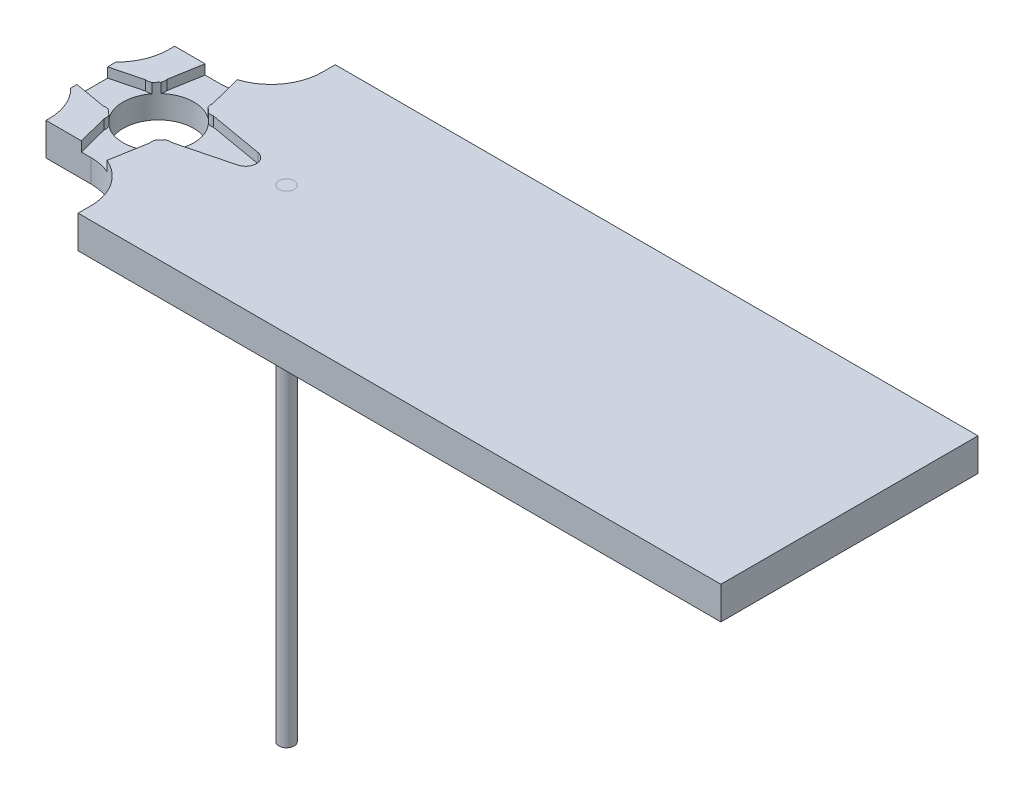
from build123d import *

# Parameters (mm, degrees)
SKETCH1_R           = 1.5
BOSS_EXTRUDE1_DEPTH = 6.4516
SKETCH2_3_R         = 6.985
CUT_EXTRUDE2_DEPTH  = 19.97964
CAVITY1_START       = 4.521642996
CAVITY1_OUTLINE_R   = 0.7575
CAVITY1_DEPTH       = 1.929957004
SKETCH3_R           = 0.7575
CUT_EXTRUDE3_DEPTH  = 139.94128573
SKETCH4_R           = 1.5
BOSS_EXTRUDE2_DEPTH = 95.25
FILLET1_R           = 10.16


with BuildPart() as part:
    # Sketch1 → Boss-Extrude1 (new body)
    with BuildSketch(Plane(origin=(0, 0, 0), x_dir=(1, 0, 0), z_dir=(0, 1, 0))):
        Polygon((-12.598868717, 4.18434255), (-12.598868717, -4.742883604), (-9.525, -5.534097084), (-9.525, -12.7), (9.525, -12.7), (9.525, -25.4), (136.525, -25.4), (136.525, 25.4), (9.525, 25.4), (9.525, 12.7), (-9.525, 12.7), (-9.525, 4.975556031), align=None)
        with Locations(Location((25.298868717, 0, 0), (0, 0, 270))):
            Circle(SKETCH1_R, mode=Mode.SUBTRACT)
    extrude(amount=BOSS_EXTRUDE1_DEPTH)

    # Sketch2<3> → Cut-Extrude2 (cut)
    with BuildSketch(Plane(origin=(0, 6.4516, 0), x_dir=(1, 0, 0), z_dir=(0, 1, 0))):
        with Locations(Location((0, 0, 0), (0, 0, 270))):
            Circle(SKETCH2_3_R)
    extrude(amount=-CUT_EXTRUDE2_DEPTH, mode=Mode.SUBTRACT)

    # Cavity1: read off the stored shape, not the designer's step
    # Cavity1 outline → Cavity1 (cut)
    # profile 1 of 4: a face of its own
    with BuildSketch(Plane(origin=(0, 0, 0), x_dir=(1, 0, 0), z_dir=(0, 1, 0)).offset(CAVITY1_START)):
        with BuildLine():
            ThreePointArc((-0.835841276, 6.934810333), (-0.328024221, 8.224961542), (0.280923041, 6.979348626))
            ThreePointArc((0.280923041, 6.979348626), (2.378348231, 6.567623976), (4.253065237, 5.540907966))
            ThreePointArc((4.253065237, 5.540907966), (4.081154126, 6.075770836), (4.081735433, 6.637581642))
            Line((4.081735433, 6.637581642), (2.521269592, 12.7))
            Line((2.521269592, 12.7), (-3.482705917, 12.7))
            Line((-3.482705917, 12.7), (-4.59736509, 6.291445655))
            ThreePointArc((-4.59736509, 6.291445655), (-4.552045019, 5.731465467), (-4.680815563, 5.184610947))
            ThreePointArc((-4.680815563, 5.184610947), (-2.893816709, 6.357361863), (-0.835841276, 6.934810333))
        make_face()
        with Locations((-0.418583054, 10.495656446)):
            Circle(CAVITY1_OUTLINE_R, mode=Mode.SUBTRACT)
    # profile 2 of 4: a face of its own
    with BuildSketch(Plane(origin=(0, 0, 0), x_dir=(1, 0, 0), z_dir=(0, 1, 0)).offset(CAVITY1_START)):
        with BuildLine():
            ThreePointArc((6.291445655, 4.59736509), (5.731465467, 4.552045019), (5.184610947, 4.680815563))
            ThreePointArc((5.184610947, 4.680815563), (6.357361863, 2.893816709), (6.934810333, 0.835841276))
            ThreePointArc((6.934810333, 0.835841276), (8.224961542, 0.328024221), (6.979348626, -0.280923041))
            ThreePointArc((6.979348626, -0.280923041), (6.567623976, -2.378348231), (5.540907966, -4.253065237))
            ThreePointArc((5.540907966, -4.253065237), (6.075770836, -4.081154126), (6.637581642, -4.081735433))
            Line((6.637581642, -4.081735433), (17.079554107, -1.39397283))
            ThreePointArc((17.079554107, -1.39397283), (18.670158101, 0.744594857), (16.914297994, 2.749700365))
            Line((16.914297994, 2.749700365), (6.291445655, 4.59736509))
        make_face()
        with Locations((10.495656446, 0.418583054)):
            Circle(CAVITY1_OUTLINE_R, mode=Mode.SUBTRACT)
        with Locations((13.523249651, 0.539328166)):
            Circle(CAVITY1_OUTLINE_R, mode=Mode.SUBTRACT)
        with Locations((16.550842857, 0.660073278)):
            Circle(CAVITY1_OUTLINE_R, mode=Mode.SUBTRACT)
    # profile 3 of 4: a face of its own
    with BuildSketch(Plane(origin=(0, 0, 0), x_dir=(1, 0, 0), z_dir=(0, 1, 0)).offset(CAVITY1_START)):
        with BuildLine():
            ThreePointArc((-6.979348626, 0.280923041), (-6.567623976, 2.378348231), (-5.540907966, 4.253065237))
            ThreePointArc((-5.540907966, 4.253065237), (-6.075770836, 4.081154126), (-6.637581642, 4.081735433))
            Line((-6.637581642, 4.081735433), (-12.598868717, 2.547300773))
            Line((-12.598868717, 2.547300773), (-12.598868717, -3.500295986))
            Line((-12.598868717, -3.500295986), (-6.291445655, -4.59736509))
            ThreePointArc((-6.291445655, -4.59736509), (-5.731465467, -4.552045019), (-5.184610947, -4.680815563))
            ThreePointArc((-5.184610947, -4.680815563), (-6.357361863, -2.893816709), (-6.934810333, -0.835841276))
            ThreePointArc((-6.934810333, -0.835841276), (-8.224961542, -0.328024221), (-6.979348626, 0.280923041))
        make_face()
        with Locations((-10.495656446, -0.418583054)):
            Circle(CAVITY1_OUTLINE_R, mode=Mode.SUBTRACT)
    # profile 4 of 4: a face of its own
    with BuildSketch(Plane(origin=(0, 0, 0), x_dir=(1, 0, 0), z_dir=(0, 1, 0)).offset(CAVITY1_START)):
        with BuildLine():
            ThreePointArc((4.59736509, -6.291445655), (4.552045019, -5.731465467), (4.680815563, -5.184610947))
            ThreePointArc((4.680815563, -5.184610947), (2.893816709, -6.357361863), (0.835841276, -6.934810333))
            ThreePointArc((0.835841276, -6.934810333), (0.328024221, -8.224961542), (-0.280923041, -6.979348626))
            ThreePointArc((-0.280923041, -6.979348626), (-2.378348231, -6.567623976), (-4.253065237, -5.540907966))
            ThreePointArc((-4.253065237, -5.540907966), (-4.081154126, -6.075770836), (-4.081735433, -6.637581642))
            Line((-4.081735433, -6.637581642), (-2.521269592, -12.7))
            Line((-2.521269592, -12.7), (3.482705917, -12.7))
            Line((3.482705917, -12.7), (4.59736509, -6.291445655))
        make_face()
        with Locations((0.418583054, -10.495656446)):
            Circle(CAVITY1_OUTLINE_R, mode=Mode.SUBTRACT)
    extrude(amount=CAVITY1_DEPTH, mode=Mode.SUBTRACT)

    # Sketch3 → Cut-Extrude3 (cut, through all)
    with BuildSketch(Plane(origin=(0, 4.521642996, 0), x_dir=(1, 0, 0), z_dir=(0, 1, 0))):
        with Locations((0.418583054, -10.495656446)):
            Circle(SKETCH3_R)
        with Locations((16.550842857, 0.660073278)):
            Circle(SKETCH3_R)
        with Locations((13.523249651, 0.539328166)):
            Circle(SKETCH3_R)
        with Locations((10.495656446, 0.418583054)):
            Circle(SKETCH3_R)
        with Locations((-0.418583054, 10.495656446)):
            Circle(SKETCH3_R)
        with Locations((-10.495656446, -0.418583054)):
            Circle(SKETCH3_R)
        with BuildLine():
            Line((-6.979348626, 0.280923041), (-6.934810333, -0.835841276))
            ThreePointArc((-6.934810333, -0.835841276), (-8.224961542, -0.32802422), (-6.979348626, 0.280923041))
        make_face()
        with BuildLine():
            Line((-0.835841276, 6.934810333), (0.280923041, 6.979348626))
            ThreePointArc((0.280923041, 6.979348626), (-0.32802422, 8.224961542), (-0.835841276, 6.934810333))
        make_face()
        with BuildLine():
            Line((6.934810333, 0.835841276), (6.979348626, -0.280923041))
            ThreePointArc((6.979348626, -0.280923041), (8.224961542, 0.32802422), (6.934810333, 0.835841276))
        make_face()
        with BuildLine():
            Line((-0.280923041, -6.979348626), (0.835841276, -6.934810333))
            ThreePointArc((0.835841276, -6.934810333), (0.32802422, -8.224961542), (-0.280923041, -6.979348626))
        make_face()
    extrude(amount=CUT_EXTRUDE3_DEPTH, mode=Mode.SUBTRACT)

    # Fillet1
    # the kernel refuses this fillet: 10.16 mm, written as the material it adds along each edge
    with BuildSketch(Plane(origin=(-9.525, 0, -4.975556031), x_dir=(0, 0, -1), z_dir=(0, 1, 0))) as fillet1_piece_1:
        with BuildLine():
            CenterArc((6.48974411, 10.16), FILLET1_R, 224.223082624, 45.776917376)
            Line((-0.791213481, 3.073868717), (0, 0))
            Line((0, 0), (6.48974411, 0))
        make_face()
    extrude(amount=6.4516)
    with BuildSketch(Plane(origin=(-9.525, 0, 5.534097084), x_dir=(0, 0, 1), z_dir=(0, 1, 0))) as fillet1_piece_2:
        with BuildLine():
            CenterArc((6.48974411, -10.16), FILLET1_R, 90, 45.776917376)
            Line((-0.791213481, -3.073868717), (0, 0))
            Line((0, 0), (6.48974411, 0))
        make_face()
    extrude(amount=6.4516)
    with BuildSketch(Plane(origin=(9.525, 0, 12.7), x_dir=(0, 0, 1), z_dir=(0, 1, 0))) as fillet1_piece_3_section:
        with BuildLine():
            CenterArc((FILLET1_R, -FILLET1_R), FILLET1_R, 90, 90)
            Line((0, -FILLET1_R), (0, 0))
            Line((0, 0), (FILLET1_R, 0))
        make_face()
    fillet1_piece_3 = extrude(amount=6.4516, mode=Mode.PRIVATE)
    fillet1_piece_3 = split(fillet1_piece_3, bisect_by=Plane(origin=(3.660133912, 0, 11.679906164), z_dir=(0.9852084333186758, 0, 0.17136027228549955)), keep=Keep.TOP, mode=Mode.PRIVATE)
    fillet1_piece_3 = split(fillet1_piece_3, bisect_by=Plane(origin=(9.525, 4.521642996, 12.7), z_dir=(0, -1, 0)), keep=Keep.TOP, mode=Mode.PRIVATE)
    add(fillet1_piece_3)
    with BuildSketch(Plane(origin=(9.525, 0, 12.7), x_dir=(0, 0, 1), z_dir=(0, 1, 0))) as fillet1_piece_4_section:
        with BuildLine():
            CenterArc((FILLET1_R, -FILLET1_R), FILLET1_R, 90, 90)
            Line((0, -FILLET1_R), (0, 0))
            Line((0, 0), (FILLET1_R, 0))
        make_face()
    fillet1_piece_4 = extrude(amount=6.4516, mode=Mode.PRIVATE)
    fillet1_piece_4 = split(fillet1_piece_4, bisect_by=Plane(origin=(3.660133912, 0, 11.679906164), z_dir=(-0.9852084333186758, 0, -0.17136027228549955)), keep=Keep.TOP, mode=Mode.PRIVATE)
    fillet1_piece_4 = split(fillet1_piece_4, bisect_by=Plane(origin=(9.525, 4.521642996, 12.7), z_dir=(0, -1, 0)), keep=Keep.TOP, mode=Mode.PRIVATE)
    add(fillet1_piece_4)
    with BuildSketch(Plane(origin=(9.525, 0, 12.7), x_dir=(0, 0, 1), z_dir=(0, 1, 0))) as fillet1_piece_5_section:
        with BuildLine():
            CenterArc((FILLET1_R, -FILLET1_R), FILLET1_R, 90, 90)
            Line((0, -FILLET1_R), (0, 0))
            Line((0, 0), (FILLET1_R, 0))
        make_face()
    fillet1_piece_5 = extrude(amount=6.4516, mode=Mode.PRIVATE)
    fillet1_piece_5 = split(fillet1_piece_5, bisect_by=Plane(origin=(3.660133912, 0, 11.679906164), z_dir=(0.9852084333186758, 0, 0.17136027228549955)), keep=Keep.TOP, mode=Mode.PRIVATE)
    fillet1_piece_5 = split(fillet1_piece_5, bisect_by=Plane(origin=(9.525, 4.521642996, 12.7), z_dir=(0, 1, 0)), keep=Keep.TOP, mode=Mode.PRIVATE)
    add(fillet1_piece_5)
    with BuildSketch(Plane(origin=(9.525, 0, -12.7), x_dir=(0, 0, -1), z_dir=(0, 1, 0))) as fillet1_piece_6_section:
        with BuildLine():
            CenterArc((FILLET1_R, FILLET1_R), FILLET1_R, 180, 90)
            Line((0, FILLET1_R), (0, 0))
            Line((0, 0), (FILLET1_R, 0))
        make_face()
    fillet1_piece_6 = extrude(amount=6.4516, mode=Mode.PRIVATE)
    fillet1_piece_6 = split(fillet1_piece_6, bisect_by=Plane(origin=(9.525, 4.521642996, -12.7), z_dir=(0, -1, 0)), keep=Keep.TOP, mode=Mode.PRIVATE)
    fillet1_piece_6 = split(fillet1_piece_6, bisect_by=Plane(origin=(2.956465884, 0, -11.009260017), z_dir=(0.9684328656786102, 0, -0.24927451669497816)), keep=Keep.TOP, mode=Mode.PRIVATE)
    add(fillet1_piece_6)
    with BuildSketch(Plane(origin=(9.525, 0, -12.7), x_dir=(0, 0, -1), z_dir=(0, 1, 0))) as fillet1_piece_7_section:
        with BuildLine():
            CenterArc((FILLET1_R, FILLET1_R), FILLET1_R, 180, 90)
            Line((0, FILLET1_R), (0, 0))
            Line((0, 0), (FILLET1_R, 0))
        make_face()
    fillet1_piece_7 = extrude(amount=6.4516, mode=Mode.PRIVATE)
    fillet1_piece_7 = split(fillet1_piece_7, bisect_by=Plane(origin=(9.525, 4.521642996, -12.7), z_dir=(0, -1, 0)), keep=Keep.TOP, mode=Mode.PRIVATE)
    fillet1_piece_7 = split(fillet1_piece_7, bisect_by=Plane(origin=(2.956465884, 0, -11.009260017), z_dir=(-0.9684328656786102, 0, 0.24927451669497816)), keep=Keep.TOP, mode=Mode.PRIVATE)
    add(fillet1_piece_7)
    with BuildSketch(Plane(origin=(9.525, 0, -12.7), x_dir=(0, 0, -1), z_dir=(0, 1, 0))) as fillet1_piece_8_section:
        with BuildLine():
            CenterArc((FILLET1_R, FILLET1_R), FILLET1_R, 180, 90)
            Line((0, FILLET1_R), (0, 0))
            Line((0, 0), (FILLET1_R, 0))
        make_face()
    fillet1_piece_8 = extrude(amount=6.4516, mode=Mode.PRIVATE)
    fillet1_piece_8 = split(fillet1_piece_8, bisect_by=Plane(origin=(9.525, 4.521642996, -12.7), z_dir=(0, 1, 0)), keep=Keep.TOP, mode=Mode.PRIVATE)
    fillet1_piece_8 = split(fillet1_piece_8, bisect_by=Plane(origin=(2.956465884, 0, -11.009260017), z_dir=(0.9684328656786102, 0, -0.24927451669497816)), keep=Keep.TOP, mode=Mode.PRIVATE)
    add(fillet1_piece_8)


with BuildPart() as body_2:
    # Sketch4 → Boss-Extrude2 (new body)
    with BuildSketch(Plane(origin=(0, 6.4516, 0), x_dir=(1, 0, 0), z_dir=(0, 1, 0))):
        with Locations(Location((25.298868717, 0, 0), (0, 0, 270))):
            Circle(SKETCH4_R)
    extrude(amount=-BOSS_EXTRUDE2_DEPTH)


solid = Compound([part.part, body_2.part])
